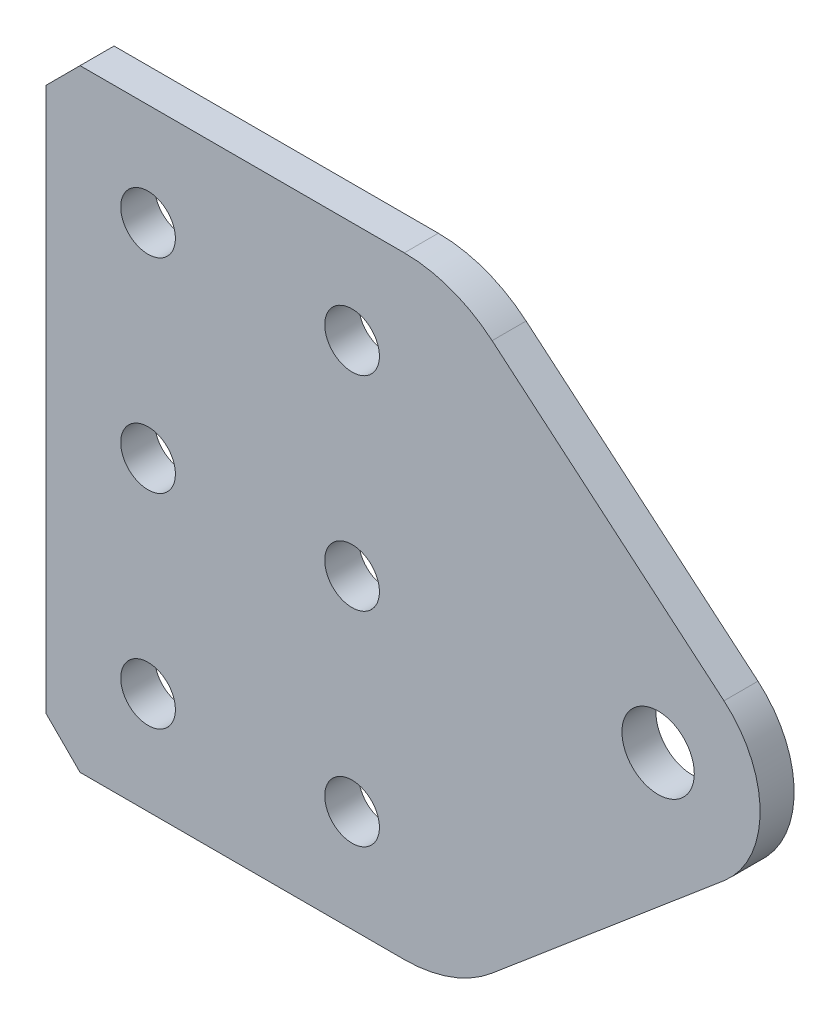
from build123d import *

# Parameters (mm, degrees)
SKETCH1_R              = 3.3782
BOSS_EXTRUDE1_DEPTH    = 3.175
F_10_CLEARANCE_HOLE1_D = 5.1054
CHAMFER1_SIZE          = 3.175


with BuildPart() as part:
    # Sketch1 → Boss-Extrude1 (new body)
    with BuildSketch(Plane.XY):
        with BuildLine():
            Line((0, 0), (33.451477372, 0))
            ThreePointArc((33.451477372, 0), (37.816769242, 0.77380082), (41.650113644, 3.000909152))
            Line((41.650113644, 3.000909152), (63.298977204, 21.300681864))
            ThreePointArc((63.298977204, 21.300681864), (66.675, 28.575), (63.298977204, 35.849318136))
            Line((63.298977204, 35.849318136), (41.650113644, 54.149090848))
            ThreePointArc((41.650113644, 54.149090848), (37.816769242, 56.37619918), (33.451477372, 57.15))
            Line((33.451477372, 57.15), (0, 57.15))
            Line((0, 57.15), (0, 0))
        make_face()
        with Locations((57.15, 28.575)):
            Circle(SKETCH1_R, mode=Mode.SUBTRACT)
    extrude(amount=BOSS_EXTRUDE1_DEPTH)

    # #10 Clearance Hole1 (through all)
    with Locations(Plane.XY.offset(3.175)):
        with Locations((28.575, 28.575), (9.525, 28.575), (9.525, 47.625), (28.575, 47.625), (28.575, 9.525), (9.525, 9.525)):
            Hole(F_10_CLEARANCE_HOLE1_D / 2)

    # Chamfer1
    chamfer1_edges = [part.edges().sort_by_distance(p)[0] for p in [
        (0, 0, 1.5875),
        (0, 57.15, 1.5875),
    ]]
    chamfer(chamfer1_edges, length=CHAMFER1_SIZE)


solid = part.part
